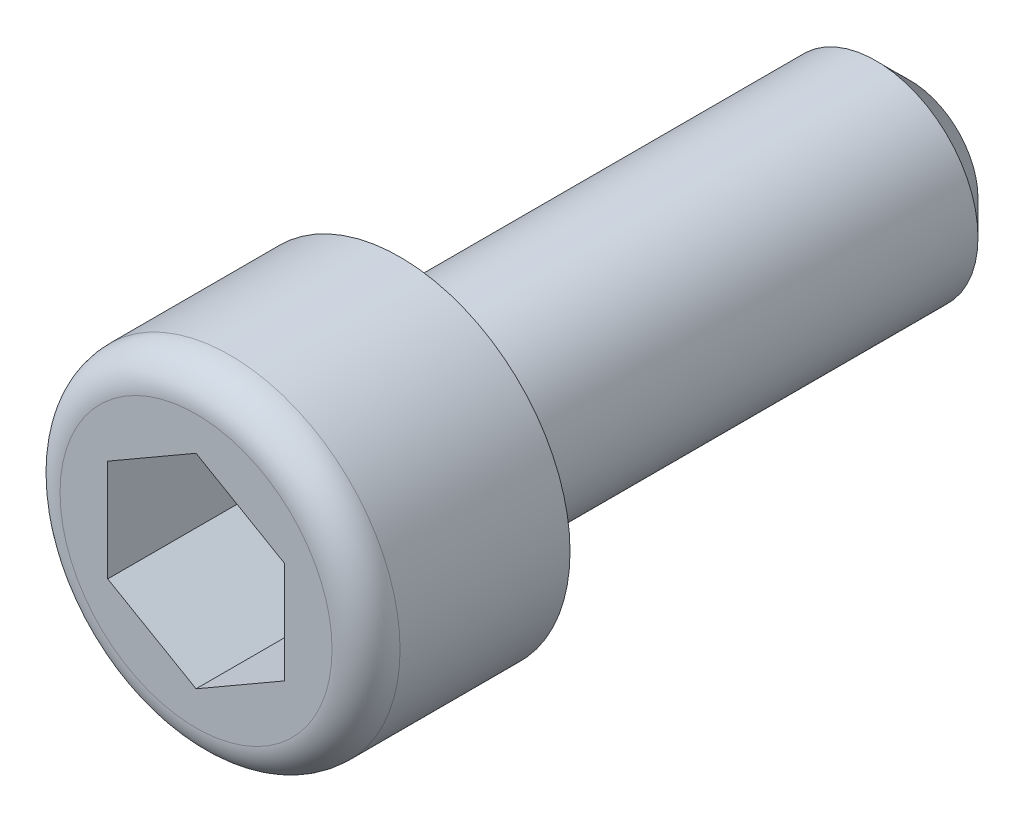
from build123d import *

# Parameters (mm, degrees)
FOOTPRINT_DEPTH = 4.5
CHAMFER1_SIZE   = 1
FILLET1_R       = 1


with BuildPart() as part:
    # Sketch1 → Body (revolve)
    with BuildSketch(Plane(origin=(0, 0, 0), x_dir=(0, 0, -1), z_dir=(1, 0, 0))):
        Polygon((0, 0), (0, 5), (6, 5), (6, 3), (21, 3), (21, 0), align=None)
    revolve(axis=Axis((0, 0, 156.291575099), (0, 0, -1)))

    # Sketch2 → Footprint (cut)
    with BuildSketch(Plane.XY):
        Polygon((0, 3), (-2.598076211, 1.5), (-2.598076211, -1.5), (0, -3), (2.598076211, -1.5), (2.598076211, 1.5), align=None)
    extrude(amount=-FOOTPRINT_DEPTH, mode=Mode.SUBTRACT)

    # Chamfer1
    chamfer1_edges = [part.edges().sort_by_distance(p)[0] for p in [
        (0, -3, -21),
    ]]
    chamfer(chamfer1_edges, length=CHAMFER1_SIZE)

    # Fillet1
    fillet1_edges = [part.edges().sort_by_distance(p)[0] for p in [
        (0, -5, 0),
    ]]
    fillet(fillet1_edges, radius=FILLET1_R)


solid = part.part
